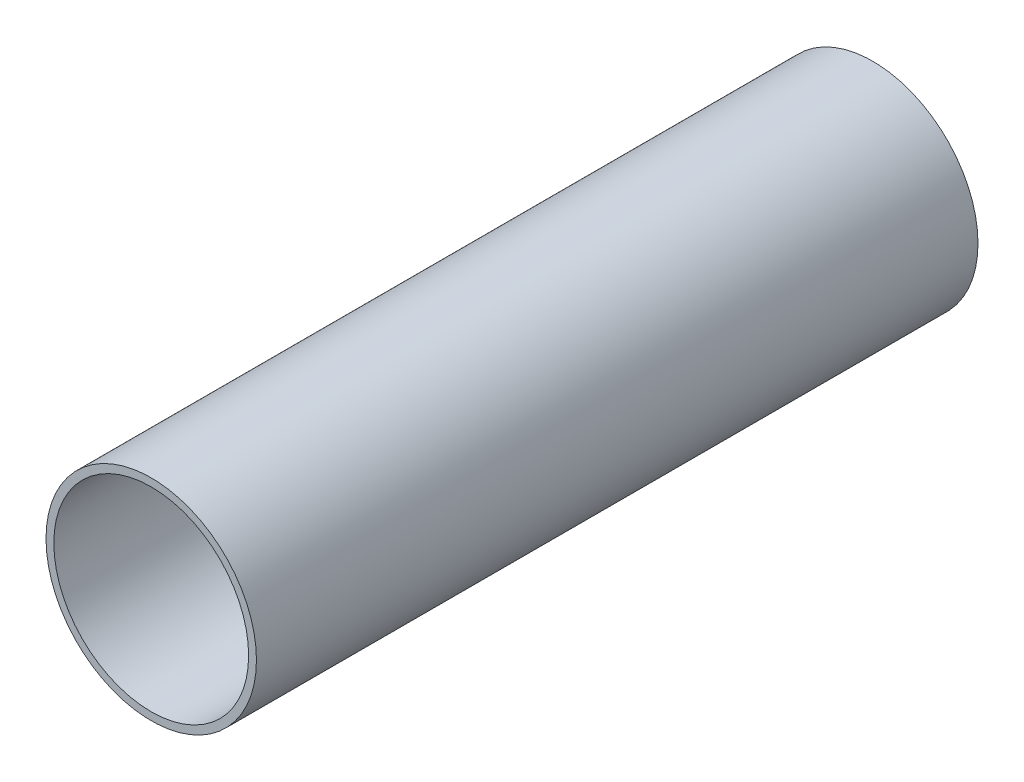
from build123d import *

# Parameters (mm, degrees)
SKETCH1_R           = 22.225
SKETCH1_R_2         = 20.574
BOSS_EXTRUDE1_DEPTH = 152.4


with BuildPart() as part:
    # Sketch1 → Boss-Extrude1 (new body)
    with BuildSketch(Plane.XY):
        Circle(SKETCH1_R)
        Circle(SKETCH1_R_2, mode=Mode.SUBTRACT)
    extrude(amount=BOSS_EXTRUDE1_DEPTH)


solid = part.part
